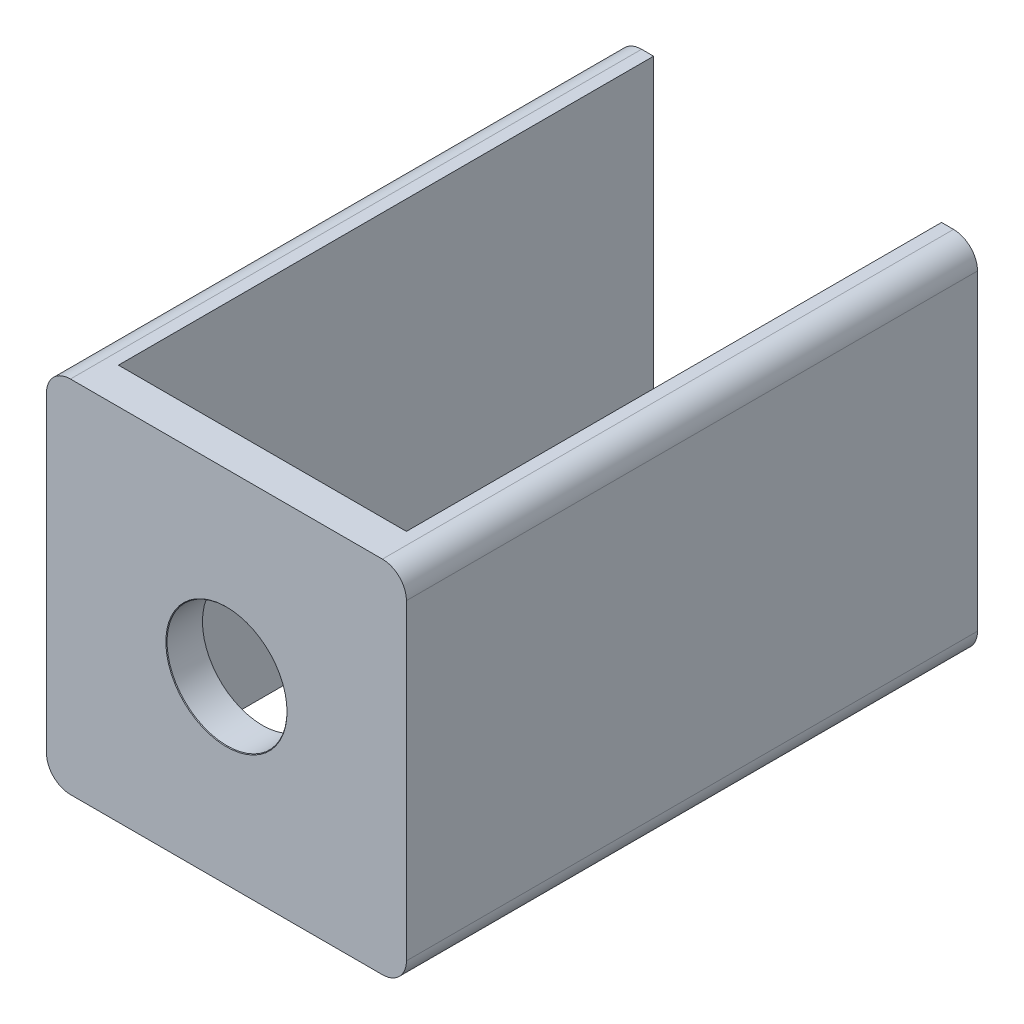
from build123d import *

# Parameters (mm, degrees)
SZKIC1_W                    = 15
SZKIC1_H                    = 15
DODANIE_WYCI_GNI_CIE2_DEPTH = 23.8
SKORUPA3_T                  = -1.5
ZAOKR_GLENIE1_R             = 1


# Read off the part's stored shape, not the designer's step: Pogłębienie walcowe pod M2 Śrubę z łbem stożkowym ściętym1
with BuildPart() as part:
    # Szkic1 → Dodanie-wyciągnięcie2 (new body)
    with BuildSketch(Plane.XY):
        with Locations((9.359290026, -2.777742542)):
            Rectangle(SZKIC1_W, SZKIC1_H)
    extrude(amount=DODANIE_WYCI_GNI_CIE2_DEPTH)

    # Skorupa3
    skorupa3_openings = [part.faces().sort_by_distance(p)[0] for p in [
        (9.359290026, -2.777742542, 0),
        (9.359290026, -10.277742542, 11.9),
        (9.359290026, 4.722257458, 11.9),
    ]]
    offset(amount=SKORUPA3_T, openings=skorupa3_openings, kind=Kind.INTERSECTION)

    # Zaokrąglenie1
    zaokr_glenie1_edges = [part.edges().sort_by_distance(p)[0] for p in [
        (16.859290026, -10.277742542, 11.9),
        (1.859290026, -10.277742542, 11.9),
        (1.859290026, 4.722257458, 11.9),
        (16.859290026, 4.722257458, 11.9),
    ]]
    fillet(zaokr_glenie1_edges, radius=ZAOKR_GLENIE1_R)

    # Pog_bienie walcowe pod M2 _rub_ z _b 2 → Pogłębienie walcowe pod M2 Śrubę z łbem stożkowym ściętym1 (revolve, cut)
    with BuildSketch(Plane(origin=(9.359290026, -2.777742542, 0), x_dir=(1, 0, 0), z_dir=(0, -1, 0))):
        Polygon((2.525, 23.8), (0, 23.8), (0, 22.3), (2.5, 22.3), (2.5, 23.775), align=None)
    revolve(axis=Axis((9.359290026, -2.777742542, 0), (0, 0, 1)), mode=Mode.SUBTRACT)


solid = part.part
